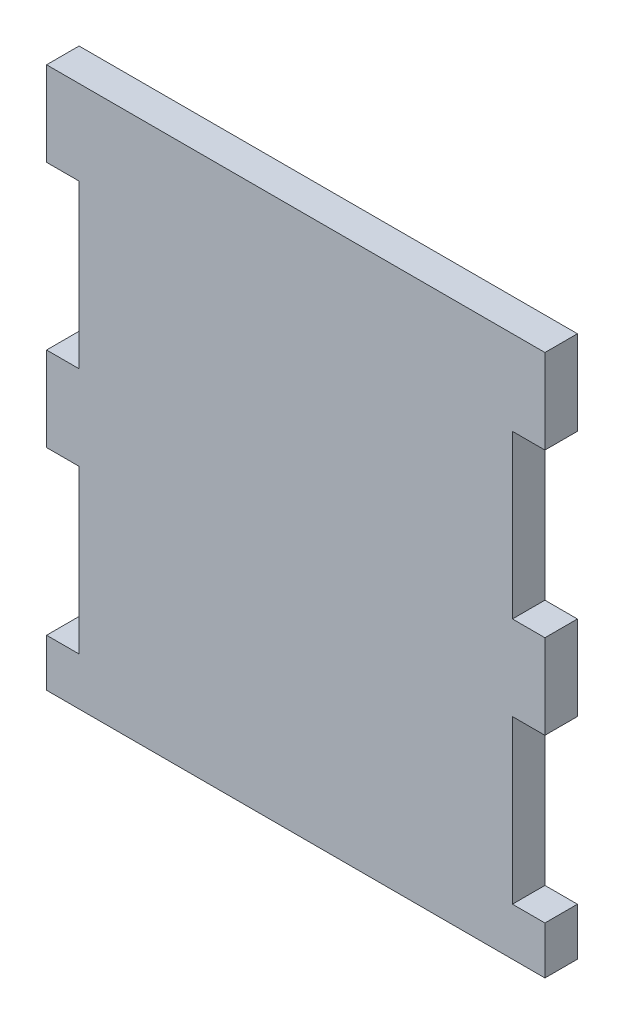
from build123d import *

# Parameters (mm, degrees)
SKETCH1_W           = 46
SKETCH1_H           = 50
BOSS_EXTRUDE1_DEPTH = 3
SKETCH2_W           = 3
SKETCH2_H           = 15
CUT_EXTRUDE1_DEPTH  = 53.999062732
LPATTERN1_COUNT     = 3
LPATTERN1_PITCH     = 22.8


with BuildPart() as part:
    # Sketch1 → Boss-Extrude1 (new body)
    with BuildSketch(Plane.XY):
        with Locations((-17.993460648, -8.457986111)):
            Rectangle(SKETCH1_W, SKETCH1_H)
    extrude(amount=BOSS_EXTRUDE1_DEPTH)

    # Sketch2 → Cut-Extrude1 (cut, through all)
    with BuildSketch(Plane.XY.offset(3)):
        with Locations((-39.493460648, 1.242013889)):
            Rectangle(SKETCH2_W, SKETCH2_H)
        with Locations((3.506539352, 1.242013889)):
            Rectangle(SKETCH2_W, SKETCH2_H)
    cut_extrude1 = extrude(amount=-CUT_EXTRUDE1_DEPTH, mode=Mode.SUBTRACT)

    # LPattern1: Cut-Extrude1 ×3
    with Locations(*[(0, -i * LPATTERN1_PITCH, 0) for i in range(1, LPATTERN1_COUNT)]):
        add(cut_extrude1, mode=Mode.SUBTRACT)


solid = part.part
